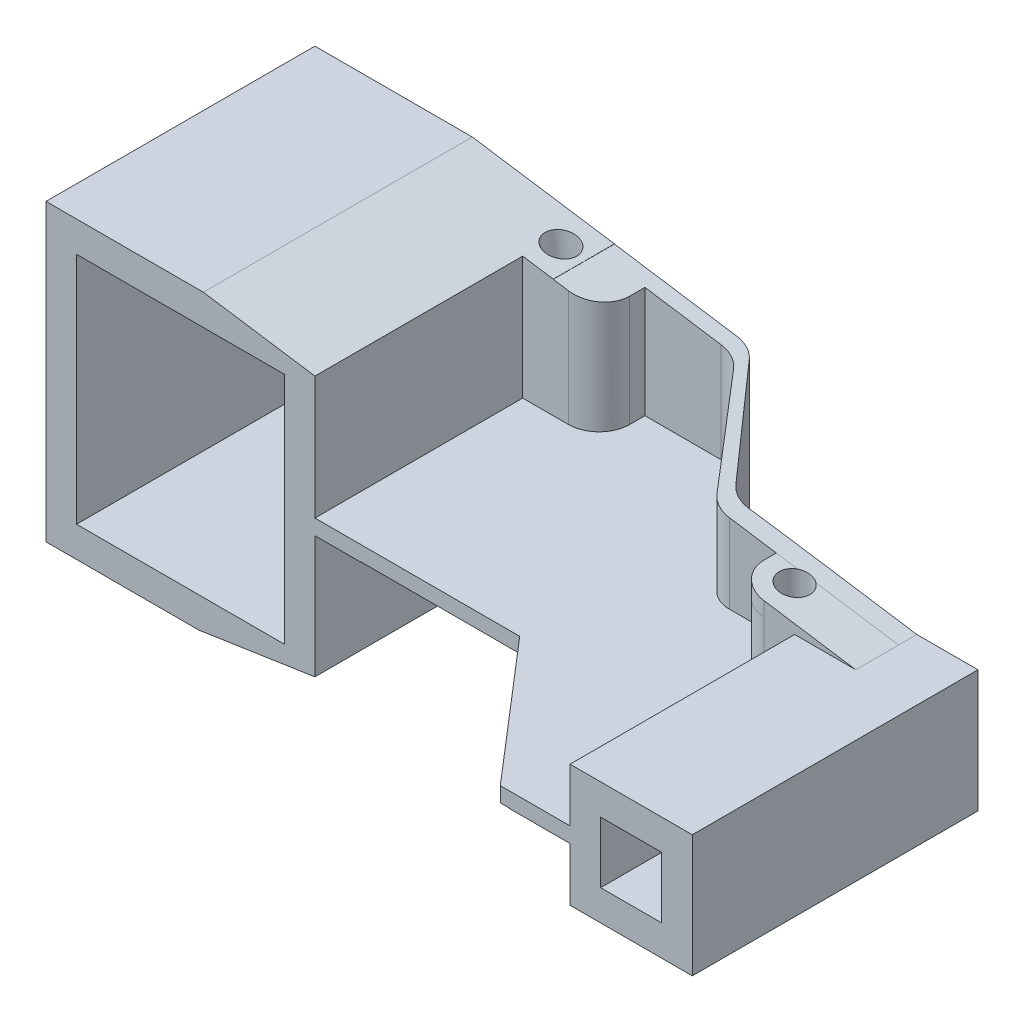
from build123d import *

# Parameters (mm, degrees)
ESQUISSE1_W                   = 68
ESQUISSE1_H                   = 76.5
BOSS_EXTRU_1_DEPTH            = 88
BOSS_EXTRU_4_DEPTH            = 88
ESQUISSE3_W                   = 19.543482411
ESQUISSE3_H                   = 40.235962567
ESQUISSE3_W_2                 = 20.972353068
ESQUISSE3_H_2                 = 40.009358289
ENL_V_MAT_EXTRU_1_DEPTH       = 68
ESQUISSE8_W                   = 10
ESQUISSE8_H                   = 20
BOSS_EXTRU_9_DEPTH            = 96.5
ENL_V_MAT_EXTRU_2_DEPTH       = 140.000518873
ESQUISSE10_R                  = 5
ENL_V_MAT_EXTRU_3_DEPTH       = 170.968886377
ESQUISSE17_W                  = 10
ESQUISSE17_H                  = 4.881451094
BOSS_EXTRU_16_DEPTH           = 68
CONG_2_R                      = 10
BOSS_EXTRU_19_DEPTH           = 56
BOSS_EXTRU_19_DEPTH_BACK      = 85
ESQUISSE19_W                  = 40
ESQUISSE19_H                  = 40
ESQUISSE19_W_2                = 20
ESQUISSE19_H_2                = 20
ESQUISSE20_W                  = 60
ESQUISSE20_H                  = 40
ENL_V_MAT_EXTRU_4_DEPTH       = 216.978999532
ESQUISSE21_W                  = 40
ESQUISSE21_H                  = 10.5
ENL_V_MAT_EXTRU_5_DEPTH       = 216.978999532
ESQUISSE22_W                  = 10
ESQUISSE22_H                  = 20
BOSS_EXTRU_23_DEPTH           = 40
ESQUISSE23_W                  = 10
ESQUISSE23_H                  = 5
BOSS_EXTRU_24_DEPTH           = 93.5
ESQUISSE24_W                  = 10
ESQUISSE24_H                  = 20
BOSS_EXTRU_25_DEPTH           = 40
ESQUISSE25_W                  = 10
ESQUISSE25_H                  = 5
BOSS_EXTRU_26_DEPTH           = 83.5
ESQUISSE26_W                  = 10
ESQUISSE26_H                  = 10
ENL_V_MAT_EXTRU_6_DEPTH       = 211.762136635
CONG_3_R                      = 10
CONG_4_R                      = 10
BOSS_EXTRU_30_DEPTH           = 18
BOSS_EXTRU_30_DEPTH_BACK      = 59
ENL_V_MAT_EXTRU_9_DEPTH       = 180.786479578
BOSS_EXTRU_33_DEPTH           = 20
CONG_8_R                      = 10
ENL_V_MAT_EXTRU_12_DEPTH      = 32
ENL_V_MAT_EXTRU_12_DEPTH_BACK = 210.124791067
ESQUISSE41_R                  = 5
BOSS_EXTRU_34_DEPTH           = 14
BOSS_EXTRU_34_DEPTH_BACK      = 55
ENL_V_MAT_EXTRU_15_DEPTH      = 177.740426159
BOSS_EXTRU_36_REACH           = 178.988
ESQUISSE47_W                  = 84
ESQUISSE47_H                  = 4.881451094
ESQUISSE50_W                  = 75.146765922
ESQUISSE50_H                  = 4.881451094
BOSS_EXTRU_38_DEPTH           = 45.5
ENL_V_MAT_EXTRU_16_DEPTH      = 220.971283896


with BuildPart() as part:
    # Esquisse1 → Boss.-Extru.1 (new body)
    with BuildSketch(Plane.XY):
        Polygon((-111.216373557, -48.25), (-61.216373557, -48.25), (-23.216373557, -42.509358289), (-23.216373557, 42.509358289), (-61.216373557, 48.25), (-111.216373557, 48.25), align=None)
        with Locations((-67.216373557, 0)):
            Rectangle(ESQUISSE1_W, ESQUISSE1_H, mode=Mode.SUBTRACT)
    extrude(amount=BOSS_EXTRU_1_DEPTH)

    # Esquisse2 → Boss.-Extru.4 (add)
    with BuildSketch(Plane.XY.offset(88)):
        Polygon((-8.216373557, 40.469919786), (-59.716373557, 48.25), (-61.216373557, 48.25), (-23.216373557, 42.509358289), (-23.216373557, -42.27382473), (-8.216373557, -39.817862291), align=None)
    extrude(amount=-BOSS_EXTRU_4_DEPTH)

    # Esquisse3 → Enlèv. mat.-Extru.1 (cut)
    with BuildSketch(Plane.XY.offset(88)):
        with Locations((-13.444632352, 22.617981284)):
            Rectangle(ESQUISSE3_W, ESQUISSE3_H)
        with Locations((-12.730197023, -22.504679145)):
            Rectangle(ESQUISSE3_W_2, ESQUISSE3_H_2)
    extrude(amount=-ENL_V_MAT_EXTRU_1_DEPTH, mode=Mode.SUBTRACT)

    # Esquisse8 → Boss.-Extru.9 (add, through all)
    with BuildSketch(Plane.XZ.offset(48.25)):
        with Locations((-3.216373557, 10)):
            Rectangle(ESQUISSE8_W, ESQUISSE8_H)
    extrude(amount=-BOSS_EXTRU_9_DEPTH)

    # Esquisse9 → Enlèv. mat.-Extru.2 (cut, through all)
    with BuildSketch(Plane.XY.offset(20)):
        Polygon((-8.216373557, 48.25), (-8.216373557, 40.469919786), (1.783626443, 38.959224599), (1.783626443, 48.25), align=None)
        Polygon((1.783626443, -48.25), (1.783626443, -38.732620321), (-8.216373557, -40.243315508), (-8.216373557, -48.25), align=None)
    extrude(amount=-ENL_V_MAT_EXTRU_2_DEPTH, mode=Mode.SUBTRACT)

    # Esquisse10 → Enlèv. mat.-Extru.3 (cut, through all)
    with BuildSketch(Plane(origin=(5.760556808, -38.131827365, 0), x_dir=(-0.9887806747234926, -0.149374620646731, 0), z_dir=(0.14937462064673096, -0.9887806747234925, 0))):
        with Locations(Location((14.135521377, -10, 0), (0, 0, 180))):
            Circle(ESQUISSE10_R)
    extrude(amount=-ENL_V_MAT_EXTRU_3_DEPTH, mode=Mode.SUBTRACT)

    # Esquisse17 → Boss.-Extru.16 (add, through all)
    with BuildSketch(Plane.XY.offset(20)):
        with Locations((-3.216373557, 0.059274453)):
            Rectangle(ESQUISSE17_W, ESQUISSE17_H)
    extrude(amount=BOSS_EXTRU_16_DEPTH)

    # Congé2
    cong_2_edges = [part.edges().sort_by_distance(p)[0] for p in [
        (1.783626443, 20.729612299, 20),
        (1.783626443, -20.557035707, 20),
    ]]
    fillet(cong_2_edges, radius=CONG_2_R - 0.0001)  # a hair under: the kernel refuses the full size

    # Esquisse34 → Boss.-Extru.30 (add, two sides: drawn at the far end of the back side and taken through both)
    with BuildSketch(Plane.XZ.offset(20).offset(-BOSS_EXTRU_30_DEPTH_BACK)):
        with BuildLine():
            Line((34.377909415, 8.572123903), (34.370735232, 3.444656645))
            ThreePointArc((34.370735232, 3.444656645), (30.969175902, 0.901828933), (26.819081539, 0))
            Line((26.819081539, 0), (1.783626443, 0))
            Line((1.783626443, 0), (1.783626443, 5))
            Line((1.783626443, 5), (26.717464984, 5))
            ThreePointArc((26.717464984, 5), (30.943647601, 5.93692213), (34.377909415, 8.572123903))
        make_face()
    extrude(amount=BOSS_EXTRU_30_DEPTH + BOSS_EXTRU_30_DEPTH_BACK)

    # Esquisse35 → Enlèv. mat.-Extru.9 (cut, through all)
    with BuildSketch(Plane(origin=(0, 0, 40), x_dir=(-1, 0, 0), z_dir=(0, 0, -1))):
        Polygon((0, -39.002071909), (-46.91486771, -31.914665424), (-9.768949851, -63.05793836), align=None)
        Polygon((-56.81735982, 58.483787391), (-46.91486771, 32.011010427), (13.201496413, 41.166197955), (13.201496413, 63.711388499), align=None)
    extrude(amount=ENL_V_MAT_EXTRU_9_DEPTH, mode=Mode.SUBTRACT)



with BuildPart() as body_2:
    # Esquisse19 → Boss.-Extru.19 (new, two sides: drawn at the far end of the back side and taken through both)
    with BuildSketch(Plane.XY.offset(88).offset(-BOSS_EXTRU_19_DEPTH_BACK)):
        with Locations((125.783626443, 0)):
            Rectangle(ESQUISSE19_W, ESQUISSE19_H)
        with Locations((125.783626443, 0)):
            Rectangle(ESQUISSE19_W_2, ESQUISSE19_H_2, mode=Mode.SUBTRACT)
    extrude(amount=BOSS_EXTRU_19_DEPTH + BOSS_EXTRU_19_DEPTH_BACK)

    # Esquisse20 → Enlèv. mat.-Extru.4 (cut, through all)
    with BuildSketch(Plane.XZ.offset(20)):
        with Locations((134.192494857, 20)):
            Rectangle(ESQUISSE20_W, ESQUISSE20_H)
    extrude(amount=-ENL_V_MAT_EXTRU_4_DEPTH, mode=Mode.SUBTRACT)

    # Esquisse21 → Enlèv. mat.-Extru.5 (cut, through all)
    with BuildSketch(Plane.XZ.offset(20)):
        with Locations((125.783626443, 138.75)):
            Rectangle(ESQUISSE21_W, ESQUISSE21_H)
    extrude(amount=-ENL_V_MAT_EXTRU_5_DEPTH, mode=Mode.SUBTRACT)

    # Esquisse22 → Boss.-Extru.23 (add)
    with BuildSketch(Plane.XZ.offset(20)):
        with Locations((100.783626443, 50)):
            Rectangle(ESQUISSE22_W, ESQUISSE22_H)
    extrude(amount=-BOSS_EXTRU_23_DEPTH)

    # Esquisse23 → Boss.-Extru.24 (add)
    with BuildSketch(Plane.XY.offset(133.5)):
        with Locations((100.783626443, 0)):
            Rectangle(ESQUISSE23_W, ESQUISSE23_H)
    extrude(amount=-BOSS_EXTRU_24_DEPTH)

    # Esquisse24 → Boss.-Extru.25 (add)
    with BuildSketch(Plane.XZ.offset(20)):
        with Locations((90.783626443, 50)):
            Rectangle(ESQUISSE24_W, ESQUISSE24_H)
    extrude(amount=-BOSS_EXTRU_25_DEPTH)

    # Esquisse25 → Boss.-Extru.26 (add)
    with BuildSketch(Plane.XY.offset(60)):
        with Locations((90.783626443, 0)):
            Rectangle(ESQUISSE25_W, ESQUISSE25_H)
    extrude(amount=BOSS_EXTRU_26_DEPTH)

    # Esquisse26 → Enlèv. mat.-Extru.6 (cut, through all)
    with BuildSketch(Plane.XZ.offset(2.5)):
        with Locations((90.783626443, 138.5)):
            Rectangle(ESQUISSE26_W, ESQUISSE26_H)
    extrude(amount=-ENL_V_MAT_EXTRU_6_DEPTH, mode=Mode.SUBTRACT)

    # Congé3
    cong_3_edges = [body_2.edges().sort_by_distance(p)[0] for p in [
        (85.783626443, -11.25, 60),
    ]]
    fillet(cong_3_edges, radius=CONG_3_R)

    # Congé4
    cong_4_edges = [body_2.edges().sort_by_distance(p)[0] for p in [
        (85.783626443, 11.25, 60),
    ]]
    fillet(cong_4_edges, radius=CONG_4_R)

    # Esquisse40 → Boss.-Extru.33 (add)
    with BuildSketch(Plane(origin=(0, 0, 40), x_dir=(-1, 0, 0), z_dir=(0, 0, -1))):
        Polygon((-85.783626443, -20), (-125.783626443, -20), (-85.783626443, -26.042780749), align=None)
        Polygon((-85.783626443, 26.105828189), (-125.783626443, 20), (-85.783626443, 20), align=None)
    extrude(amount=-BOSS_EXTRU_33_DEPTH)

    # Congé8
    cong_8_edges = [body_2.edges().sort_by_distance(p)[0] for p in [
        (85.783626443, -23.021390374, 60),
        (85.783626443, 23.052914094, 60),
    ]]
    fillet(cong_8_edges, radius=CONG_8_R)

    # Esquisse41 → Enlèv. mat.-Extru.12 (cut, two sides: drawn at the far end of the back side and taken through both)
    with BuildSketch(Plane.XZ.offset(20).offset(-ENL_V_MAT_EXTRU_12_DEPTH_BACK)):
        with Locations(Location((95.783626443, 50, 0), (0, 0, 180))):
            Circle(ESQUISSE41_R)
    extrude(amount=ENL_V_MAT_EXTRU_12_DEPTH + ENL_V_MAT_EXTRU_12_DEPTH_BACK, mode=Mode.SUBTRACT)


with BuildPart() as part_1:
    add(part.part)

    add(body_2.part)  # Boss.-Extru.34 merges body 2
    # Esquisse42 → Boss.-Extru.34 (add, two sides: drawn at the far end of the back side and taken through both)
    with BuildSketch(Plane.XZ.offset(20).offset(-BOSS_EXTRU_34_DEPTH_BACK)):
        with BuildLine():
            Line((85.783626443, 46), (70.446703025, 46))
            ThreePointArc((70.446703025, 46), (66.220520407, 45.06307787), (62.786258594, 42.427876097))
            Line((62.786258594, 42.427876097), (34.377909415, 8.572123903))
            Line((34.377909415, 8.572123903), (34.370735232, 3.444656645))
            Line((34.370735232, 3.444656645), (63.202936222, 36.658904216))
            ThreePointArc((63.202936222, 36.658904216), (66.635938394, 39.216008921), (70.823654148, 40.103322365))
            Line((70.823654148, 40.103322365), (85.783626443, 40))
            Line((85.783626443, 40), (85.783626443, 46))
        make_face()
    extrude(amount=BOSS_EXTRU_34_DEPTH + BOSS_EXTRU_34_DEPTH_BACK)

    # Esquisse46 → Enlèv. mat.-Extru.15 (cut, through all)
    with BuildSketch(Plane.XY.offset(46)):
        Polygon((125.783626443, 20), (1.783626443, 38.884097035), (91.450217157, 42.474258999), align=None)
        Polygon((125.783626443, -20), (34.377909415, -34), (1.783626443, -38), (94.864318468, -42.795104314), align=None)
    extrude(amount=-ENL_V_MAT_EXTRU_15_DEPTH, mode=Mode.SUBTRACT)

    # Esquisse47 → Boss.-Extru.36 (add, up to next)
    with BuildSketch(Plane.XY.offset(88), mode=Mode.PRIVATE) as boss_extru_36_sk1:
        with Locations((43.783626443, 0.059274453)):
            Rectangle(ESQUISSE47_W, ESQUISSE47_H)
    boss_extru_36_tool1 = extrude(boss_extru_36_sk1.sketch, amount=-BOSS_EXTRU_36_REACH, mode=Mode.PRIVATE) - part_1.part
    add(boss_extru_36_tool1.solids().sort_by_distance((43.783626, 0.059274, 88))[0])

    # Esquisse50 → Boss.-Extru.38 (add, through all)
    with BuildSketch(Plane.XY.offset(88)):
        with Locations((48.32250802, 0.059274453)):
            Rectangle(ESQUISSE50_W, ESQUISSE50_H)
    extrude(amount=BOSS_EXTRU_38_DEPTH)

    # Esquisse51 → Enlèv. mat.-Extru.16 (cut, through all)
    with BuildSketch(Plane.XZ.offset(48.25)):
        Polygon((82.955365358, 133.5), (10.749125059, 133.5), (10.749125059, 88), (43.801721697, 88), align=None)
    extrude(amount=-ENL_V_MAT_EXTRU_16_DEPTH, mode=Mode.SUBTRACT)


solid = part_1.part
